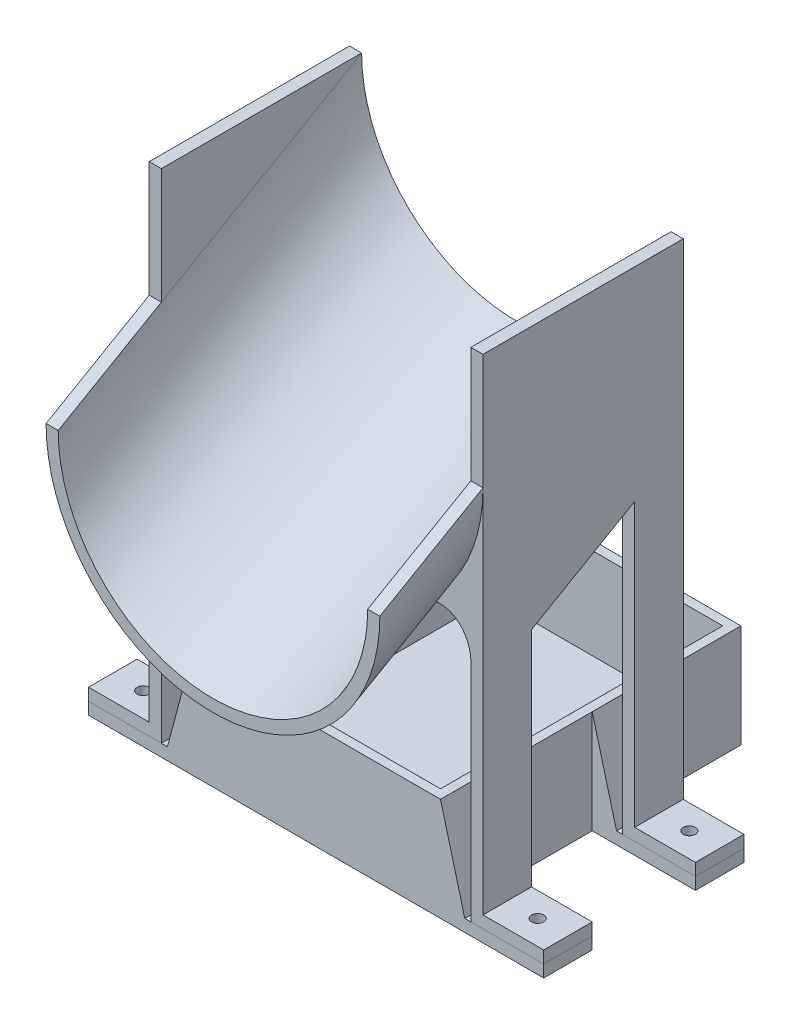
from build123d import *
from OCP.BRepFilletAPI import BRepFilletAPI_MakeChamfer

# Parameters (mm, degrees)
BOSS_EXTRUDE1_DEPTH     = 33
CUT_EXTRUDE1_REACH      = 99.714
SKETCH5_R               = 1
CUT_EXTRUDE2_DEPTH      = 2
FILLET1_R               = 5
BOSS_EXTRUDE3_OUTLINE_R = 1
BOSS_EXTRUDE3_DEPTH     = 2
SKETCH6_3_W             = 38
SKETCH6_3_H             = 46.5
BOSS_EXTRUDE4_DEPTH     = 15
CHAMFER1_SIZE           = 15
CHAMFER1_SIZE_2         = 4
CHAMFER2_SIZE           = 15
CHAMFER2_SIZE_2         = 4


with BuildPart() as part:
    # Sweep1: sweep along a path in Sketch2
    with BuildLine(Plane(origin=(0, 0, 0), x_dir=(0, 0, -1), z_dir=(1, 0, 0))) as sweep1_path:
        Line((0, 0), (50, 28.867513459))
    # Sketch1 → Sweep1 (sweep)
    with BuildSketch(Plane.XY):
        with BuildLine():
            Line((-27.5, 0), (-25.5, 0))
            ThreePointArc((-25.5, 0), (0, -25.5), (25.5, 0))
            Line((25.5, 0), (27.5, 0))
            ThreePointArc((27.5, 0), (0, -27.5), (-27.5, 0))
        make_face()
    sweep(path=sweep1_path.line)


with BuildPart() as body_2:
    # Sketch3 → Boss-Extrude1 (new body)
    with BuildSketch(Plane(origin=(0, 0, -50), x_dir=(-1, 0, 0), z_dir=(0, 0, -1))):
        Polygon((-27.5, 28.867513459), (-27.5, -51.132486541), (-37.5, -51.132486541), (-37.5, -53.132486541), (-25.5, -53.132486541), (-25.5, 28.867513459), align=None)
    extrude(amount=-BOSS_EXTRUDE1_DEPTH)

    # Cut-Extrude1: up to this face of the body (flat: up to its plane)
    cut_extrude1_end = Plane(body_2.part.faces().sort_by_distance((25.5, -12.132486541, -33.5))[0])
    # Sketch4 → Cut-Extrude1 (cut, up to the picked face)
    with BuildSketch(Plane(origin=(37.5, 0, 0), x_dir=(0, 0, -1), z_dir=(1, 0, 0)), mode=Mode.PRIVATE) as cut_extrude1_sk1:
        Polygon((25, -53.132486541), (42, -53.132486541), (42, -4.618802154), (25, -14.43375673), align=None)
    cut_extrude1_tool1 = split(extrude(cut_extrude1_sk1.sketch, amount=-CUT_EXTRUDE1_REACH, mode=Mode.PRIVATE), bisect_by=cut_extrude1_end, keep=Keep.BOTH, mode=Mode.PRIVATE)
    add(cut_extrude1_tool1.solids().sort_by(Axis((37.5, -31.237334, -33.818866), (-1, 0, 0)))[0], mode=Mode.SUBTRACT)

    # Sketch5 → Cut-Extrude2 (cut)
    with BuildSketch(Plane(origin=(0, -51.132486541, 0), x_dir=(1, 0, 0), z_dir=(0, 1, 0))):
        with Locations(Location((32.5, 21, 0), (0, 0, 180))):
            Circle(SKETCH5_R)
        with Locations(Location((32.5, 46, 0), (0, 0, 180))):
            Circle(SKETCH5_R)
    extrude(amount=-CUT_EXTRUDE2_DEPTH, mode=Mode.SUBTRACT)


with BuildPart() as body_3:
    # Mirror1: mirrored copy
    add(body_2.part.mirror(Plane(origin=(0, 0, 0), x_dir=(0, 0, 1), z_dir=(1, 0, 0))))


with BuildPart() as part_1:
    add(part.part)

    # Intersect1: read off the stored shape, not the designer's step
    # Intersect1: union body 3, body 2
    add(body_3.part)
    add(body_2.part)

    # Fillet1
    fillet1_edges = [part_1.edges().sort_by_distance(p)[0] for p in [
        (25.5, 9.045603877, -33.5),
        (-25.5, 9.045603877, -33.5),
    ]]
    fillet(fillet1_edges, radius=FILLET1_R)


with BuildPart() as body_2_2:
    # Boss-Extrude3: read off the stored shape, not the designer's step
    # Boss-Extrude3 outline → Boss-Extrude3 (new body)
    with BuildSketch(Plane.XZ.offset(53.132486541)):
        Polygon((37.5, -17), (-37.5, -17), (-37.5, -25), (-20.5, -25), (-20.5, -42), (-37.5, -42), (-37.5, -50), (-20.5, -50), (-20.5, -66.5), (20.5, -66.5), (20.5, -50), (37.5, -50), (37.5, -42), (20.5, -42), (20.5, -25), (37.5, -25), align=None)
        with Locations((-32.5, -46)):
            Circle(BOSS_EXTRUDE3_OUTLINE_R, mode=Mode.SUBTRACT)
        with Locations((32.5, -46)):
            Circle(BOSS_EXTRUDE3_OUTLINE_R, mode=Mode.SUBTRACT)
        with Locations((-32.5, -21)):
            Circle(BOSS_EXTRUDE3_OUTLINE_R, mode=Mode.SUBTRACT)
        with Locations((32.5, -21)):
            Circle(BOSS_EXTRUDE3_OUTLINE_R, mode=Mode.SUBTRACT)
    extrude(amount=BOSS_EXTRUDE3_DEPTH)

    # Sketch6<3> → Boss-Extrude4 (add)
    with BuildSketch(Plane.XZ.offset(53.132486541)):
        Polygon((20.5, -66.5), (20.5, -50), (20.5, -42), (20.5, -25), (20.5, -17), (-20.5, -17), (-20.5, -25), (-20.5, -42), (-20.5, -50), (-20.5, -66.5), align=None)
        with Locations((0, -41.75)):
            Rectangle(SKETCH6_3_W, SKETCH6_3_H, mode=Mode.SUBTRACT)
    extrude(amount=-BOSS_EXTRUDE4_DEPTH)

    # Chamfer1
    chamfer1_edges_1 = [body_2_2.edges().sort_by_distance(p)[0] for p in [
        (-20.5, -53.132486541, -46),
    ]]
    chamfer1_side_1 = [body_2_2.faces().sort_by_distance(p)[0] for p in [
        (-20.5, -53.052486541, -46),
    ]]
    chamfer1_edges_2 = [body_2_2.edges().sort_by_distance(p)[0] for p in [
        (-20.5, -53.132486541, -21),
    ]]
    chamfer1_side_2 = [body_2_2.faces().sort_by_distance(p)[0] for p in [
        (-20.5, -53.052486541, -21),
    ]]
    chamfer1 = BRepFilletAPI_MakeChamfer(body_2_2.part.solid().wrapped)
    for e in chamfer1_edges_1:
        chamfer1.Add(CHAMFER1_SIZE - 0.0001, CHAMFER1_SIZE_2 - 0.0001, e.wrapped, chamfer1_side_1[0].wrapped)
    for e in chamfer1_edges_2:
        chamfer1.Add(CHAMFER1_SIZE - 0.0001, CHAMFER1_SIZE_2 - 0.0001, e.wrapped, chamfer1_side_2[0].wrapped)
    add(Compound.cast(chamfer1.Shape()), mode=Mode.REPLACE)  # a hair under: the kernel refuses the full size

    # Chamfer2
    chamfer2_edges_1 = [body_2_2.edges().sort_by_distance(p)[0] for p in [
        (20.5, -53.132486541, -46),
    ]]
    chamfer2_side_1 = [body_2_2.faces().sort_by_distance(p)[0] for p in [
        (20.5, -53.052486541, -46),
    ]]
    chamfer2_edges_2 = [body_2_2.edges().sort_by_distance(p)[0] for p in [
        (20.5, -53.132486541, -21),
    ]]
    chamfer2_side_2 = [body_2_2.faces().sort_by_distance(p)[0] for p in [
        (20.58, -53.132486541, -21),
    ]]
    chamfer2 = BRepFilletAPI_MakeChamfer(body_2_2.part.solid().wrapped)
    for e in chamfer2_edges_1:
        chamfer2.Add(CHAMFER2_SIZE - 0.0001, CHAMFER2_SIZE_2 - 0.0001, e.wrapped, chamfer2_side_1[0].wrapped)
    for e in chamfer2_edges_2:
        chamfer2.Add(CHAMFER2_SIZE_2 - 0.0001, CHAMFER2_SIZE - 0.0001, e.wrapped, chamfer2_side_2[0].wrapped)
    add(Compound.cast(chamfer2.Shape()), mode=Mode.REPLACE)  # a hair under: the kernel refuses the full size


solid = Compound([part_1.part, body_2_2.part])
